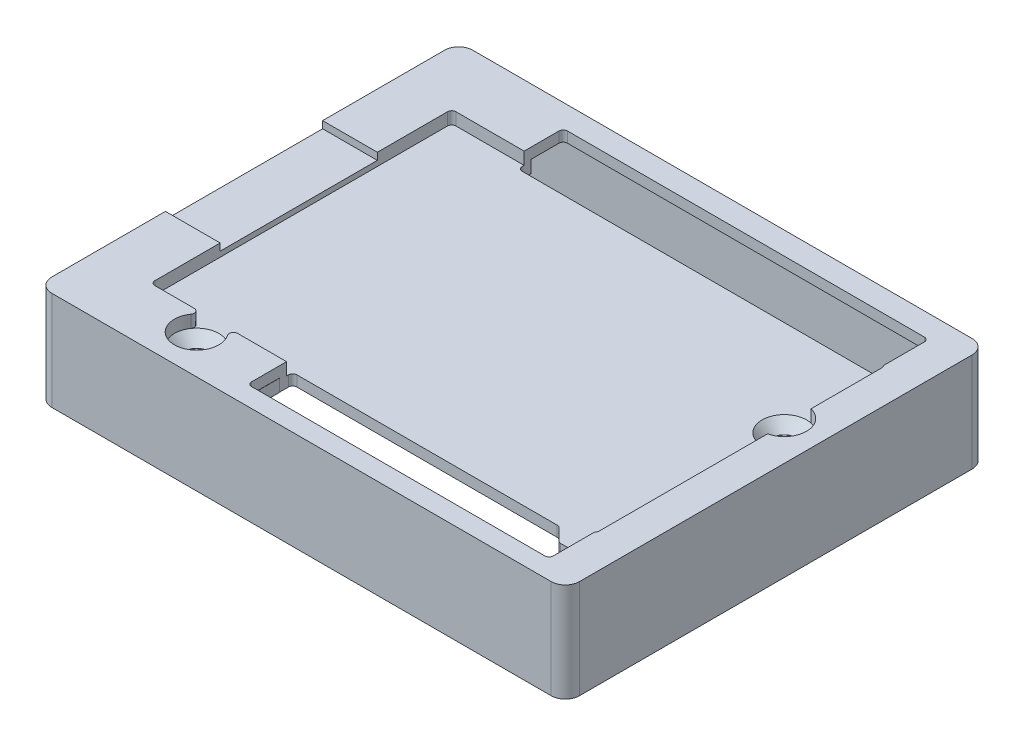
from build123d import *

# Parameters (mm, degrees)
WALLS_START                                    = 1.5
SKETCH2_W                                      = 74.7
SKETCH2_H                                      = 59.6
SKETCH2_W_2                                    = 70.7
SKETCH2_H_2                                    = 55.6
WALLS_DEPTH                                    = 12.5
BOSS_EXTRUDE2_START                            = -3
SKETCH3_W                                      = 59.6
SKETCH3_H                                      = 1.5
BOSS_EXTRUDE2_DEPTH                            = 74.7
SKETCH4_W                                      = 20.4
SKETCH4_H                                      = 16.1
CUT_EXTRUDE1_DEPTH                             = 12
SKETCH5_W                                      = 18.25
SKETCH5_H                                      = 13
CUT_EXTRUDE2_DEPTH                             = 12.1
SKETCH6_W                                      = 51.73
SKETCH6_H                                      = 6.4
SKETCH6_W_2                                    = 42.7
CUT_EXTRUDE3_DEPTH                             = 93.414555131
BOSS_EXTRUDE5_START                            = 2
BOSS_EXTRUDE5_DEPTH                            = 3.25
CUT_EXTRUDE6_DEPTH                             = 1.75
SKETCH16_W                                     = 12.95
SKETCH16_H                                     = 22.25
CUT_EXTRUDE7_DEPTH                             = 1
HOLE_PADDING_DEPTH                             = 1.5
ROOF_FILL_IN_DEPTH                             = 1.75
FILLET2_R                                      = 2
CUT_EXTRUDE9_START                             = 2
SKETCH18_W                                     = 20.4
SKETCH18_H                                     = 16.1
SKETCH18_W_2                                   = 18.25
SKETCH18_H_2                                   = 13
CUT_EXTRUDE9_DEPTH                             = 1
ROOF_FILL_IN_2_REACH                           = 94.199
CSK_FOR_M3_FLAT_HEAD_MACHINE_SCREW8_AT_2_COUNT = 2
CSK_FOR_M3_FLAT_HEAD_MACHINE_SCREW8_AT_2_PITCH = 60.711119245
HOLE_CLEARANCE_REACH                           = 94.166
SKETCH46_R                                     = 3.15
FILLET3_R                                      = 0.6


with BuildPart() as part:
    # Sketch2 → walls (new body)
    with BuildSketch(Plane(origin=(0, 0, 0), x_dir=(1, 0, 0), z_dir=(0, 1, 0)).offset(WALLS_START)):
        with Locations((34.35, 26.8)):
            Rectangle(SKETCH2_W, SKETCH2_H)
        with Locations((34.35, 26.8)):
            Rectangle(SKETCH2_W_2, SKETCH2_H_2, mode=Mode.SUBTRACT)
    extrude(amount=WALLS_DEPTH)

    # Sketch3 → Boss-Extrude2 (add)
    with BuildSketch(Plane(origin=(0, 0, 0), x_dir=(0, 0, -1), z_dir=(1, 0, 0)).offset(BOSS_EXTRUDE2_START)):
        with Locations((26.8, 14.75)):
            Rectangle(SKETCH3_W, SKETCH3_H)
    extrude(amount=BOSS_EXTRUDE2_DEPTH)

    # Sketch4 → Cut-Extrude1 (cut)
    with BuildSketch(Plane(origin=(0, 1.5, 0), x_dir=(1, 0, 0), z_dir=(0, 1, 0))):
        with Locations((1.4, 39.05)):
            Rectangle(SKETCH4_W, SKETCH4_H)
    extrude(amount=CUT_EXTRUDE1_DEPTH, mode=Mode.SUBTRACT)

    # Sketch5 → Cut-Extrude2 (cut)
    with BuildSketch(Plane(origin=(0, 1.5, 0), x_dir=(1, 0, 0), z_dir=(0, 1, 0))):
        with Locations((3.725, 8.75)):
            Rectangle(SKETCH5_W, SKETCH5_H)
    extrude(amount=CUT_EXTRUDE2_DEPTH, mode=Mode.SUBTRACT)

    # Sketch6 → Cut-Extrude3 (cut, through all)
    with BuildSketch(Plane(origin=(0, 1.5, 0), x_dir=(1, 0, 0), z_dir=(0, 1, 0))):
        with Locations((40.865, 50.2)):
            Rectangle(SKETCH6_W, SKETCH6_H)
        with Locations((45.35, 2.9)):
            Rectangle(SKETCH6_W_2, SKETCH6_H)
    extrude(amount=CUT_EXTRUDE3_DEPTH, mode=Mode.SUBTRACT)

    # Sketch13 → Boss-Extrude5 (add)
    with BuildSketch(Plane(origin=(0, 10.25, 0), x_dir=(1, 0, 0), z_dir=(0, 1, 0)).offset(BOSS_EXTRUDE5_START)):
        Polygon((3.75, 4.235), (24, 4.235), (24, 6.1), (66.7, 6.1), (66.7, 4.235), (67.9, 4.235), (67.9, 48.865), (66.73, 48.865), (66.73, 47), (15, 47), (15, 48.865), (3.75, 48.865), align=None)
    extrude(amount=BOSS_EXTRUDE5_DEPTH)

    # Sketch15 → Cut-Extrude6 (cut)
    with BuildSketch(Plane(origin=(0, 15.5, 0), x_dir=(1, 0, 0), z_dir=(0, 1, 0))):
        Polygon((4.75, 5.235), (24, 5.235), (24, 6.1), (66.9, 6.1), (66.9, 47), (15, 47), (15, 47.865), (4.75, 47.865), align=None)
    extrude(amount=-CUT_EXTRUDE6_DEPTH, mode=Mode.SUBTRACT)

    # Sketch16 → Cut-Extrude7 (cut)
    with BuildSketch(Plane(origin=(0, 15.5, 0), x_dir=(1, 0, 0), z_dir=(0, 1, 0))):
        with Locations((3.475, 26.21)):
            Rectangle(SKETCH16_W, SKETCH16_H)
    extrude(amount=-CUT_EXTRUDE7_DEPTH, mode=Mode.SUBTRACT)

    # Sketch45 → Hole padding (add)
    with BuildSketch(Plane(origin=(0, 13.75, 0), x_dir=(1, 0, 0), z_dir=(0, 1, 0))):
        Polygon((63.7, 4.1), (66.7, 4.1), (66.7, 6.1), (61.7, 6.1), align=None)
    extrude(amount=-HOLE_PADDING_DEPTH)

    # Sketch43 → Roof fill-in (add)
    with BuildSketch(Plane.XZ.offset(-14)):
        Polygon((67.9, -48.865), (67.9, -4.235), (66.7, -4.235), (66.7, -4.1), (67.9, -4.1), (69.7, -4.1), (69.7, -48.865), align=None)
    extrude(amount=ROOF_FILL_IN_DEPTH)

    # Fillet2
    fillet2_edges = [part.edges().sort_by_distance(p)[0] for p in [
        (71.7, 8.5, -56.6),
        (71.7, 8.5, 3),
        (-3, 8.5, 3),
        (-3, 8.5, -56.6),
    ]]
    fillet(fillet2_edges, radius=FILLET2_R)

    # Sketch18 → Cut-Extrude9 (cut)
    with BuildSketch(Plane(origin=(0, 10.25, 0), x_dir=(1, 0, 0), z_dir=(0, 1, 0)).offset(CUT_EXTRUDE9_START)):
        with Locations((1.4, 39.05)):
            Rectangle(SKETCH18_W, SKETCH18_H)
        with Locations((3.725, 8.75)):
            Rectangle(SKETCH18_W_2, SKETCH18_H_2)
    extrude(amount=CUT_EXTRUDE9_DEPTH, mode=Mode.SUBTRACT)

    # Roof fill in 2: up to this face of the body (flat: up to its plane)
    roof_fill_in_2_end = Plane(part.part.faces().sort_by_distance((38.949640059, 12.25, -26.379272671))[0])
    # Sketch47 → Roof fill in 2 (add, up to the picked face)
    with BuildSketch(Plane.XZ.offset(-14), mode=Mode.PRIVATE) as roof_fill_in_2_sk1:
        Polygon((3.778208992, -4.235), (11.846933601, -4.235), (11.846933601, -5.037467277), (12.85, -5.037467277), (12.85, -4.235), (24.028208992, -4.235), (24.028208992, 1), (3.778208992, 1), align=None)
    roof_fill_in_2_tool1 = split(extrude(roof_fill_in_2_sk1.sketch, amount=ROOF_FILL_IN_2_REACH, mode=Mode.PRIVATE), bisect_by=roof_fill_in_2_end, keep=Keep.BOTH, mode=Mode.PRIVATE)
    add(roof_fill_in_2_tool1.solids().sort_by(Axis((13.891493, 14, -1.640249), (0, -1, 0)))[0])

    # Sketch42 → CSK for M3 Flat Head Machine Screw8 (revolve, cut)
    with BuildSketch(Plane(origin=(66.2, 13.75, -33.5), x_dir=(0, 0, 1), z_dir=(1, 0, 0))):
        Polygon((0, 0), (0, 8.521463052), (1.7, 7.5), (1.7, 1.45), (3.15, 0), align=None)
    csk_for_m3_flat_head_machine_screw8 = revolve(axis=Axis((66.2, 20.1, -33.5), (0, -1, 0)), mode=Mode.SUBTRACT)

    # CSK for M3 Flat Head Machine Screw8 at 2: CSK for M3 Flat Head Machine Screw8 ×2
    with Locations(*[Vector(-0.8598095480534521, 0, 0.5106148657022418) * (i * CSK_FOR_M3_FLAT_HEAD_MACHINE_SCREW8_AT_2_PITCH) for i in range(1, CSK_FOR_M3_FLAT_HEAD_MACHINE_SCREW8_AT_2_COUNT)]):
        add(csk_for_m3_flat_head_machine_screw8, mode=Mode.SUBTRACT)

    # Sketch46 → Hole clearance (cut, up to next)
    with BuildSketch(Plane(origin=(0, 13.75, 0), x_dir=(1, 0, 0), z_dir=(0, 1, 0)), mode=Mode.PRIVATE) as hole_clearance_sk1:
        with Locations((66.2, 33.5)):
            Circle(SKETCH46_R)
    hole_clearance_tool1 = extrude(hole_clearance_sk1.sketch, amount=HOLE_CLEARANCE_REACH, mode=Mode.PRIVATE) & part.part
    # Sketch46 → Hole clearance (cut, up to next)
    with BuildSketch(Plane(origin=(0, 13.75, 0), x_dir=(1, 0, 0), z_dir=(0, 1, 0)), mode=Mode.PRIVATE) as hole_clearance_sk2:
        with Locations((14, 2.5)):
            Circle(SKETCH46_R)
    hole_clearance_tool2 = extrude(hole_clearance_sk2.sketch, amount=HOLE_CLEARANCE_REACH, mode=Mode.PRIVATE) & part.part
    add(hole_clearance_tool1.solids().sort_by_distance((66.2, 13.75, -33.5))[0], mode=Mode.SUBTRACT)
    add(hole_clearance_tool2.solids().sort_by_distance((14, 13.75, -2.5))[0], mode=Mode.SUBTRACT)

    # Fillet3
    # the kernel refuses this fillet: 0.6 mm, written as the material it adds along each edge
    with BuildSketch(Plane(origin=(69.7, 1.5, 1), x_dir=(-1, 0, 0), z_dir=(0, 1, 0)), Plane(origin=(-1, 1.5, 1), x_dir=(0, 0, -1), z_dir=(0, 1, 0))) as fillet3_piece_1:
        with BuildLine():
            CenterArc((FILLET3_R, -FILLET3_R), FILLET3_R, 90, 90)
            Line((0, -FILLET3_R), (0, 0))
            Line((0, 0), (FILLET3_R, 0))
        make_face()
    extrude(amount=14)
    with BuildSketch(Plane(origin=(-1, 1.5, -54.6), x_dir=(0, 0, 1), z_dir=(0, 1, 0)), Plane(origin=(69.7, 1.5, -54.6), x_dir=(-1, 0, 0), z_dir=(0, 1, 0))) as fillet3_piece_2:
        with BuildLine():
            CenterArc((FILLET3_R, FILLET3_R), FILLET3_R, 180, 90)
            Line((0, FILLET3_R), (0, 0))
            Line((0, 0), (FILLET3_R, 0))
        make_face()
    extrude(amount=14)
    with BuildSketch(Plane(origin=(12.85, 12.25, -15.25), x_dir=(0, 0, 1), z_dir=(0, 1, 0)), Plane(origin=(11.6, 12.25, -47.1), x_dir=(0, 0, 1), z_dir=(0, 1, 0)), Plane(origin=(11.6, 12.25, -31), x_dir=(-1, 0, 0), z_dir=(0, 1, 0))) as fillet3_piece_3:
        with BuildLine():
            CenterArc((FILLET3_R, -FILLET3_R), FILLET3_R, 90, 90)
            Line((0, -FILLET3_R), (0, 0))
            Line((0, 0), (FILLET3_R, 0))
        make_face()
    extrude(amount=1)
    with BuildSketch(Plane(origin=(66.9, 15.5, -6.1), x_dir=(0, 0, -1), z_dir=(0, -1, 0))) as fillet3_piece_4:
        with BuildLine():
            CenterArc((0.447213595, -0.6), FILLET3_R, 90, 48.189685102)
            Line((0, -0.2), (0, 0))
            Line((0, 0), (0.447213595, 0))
        make_face()
    extrude(amount=2.868033989)
    with BuildSketch(Plane(origin=(66.9, 15.5, -47), x_dir=(-1, 0, 0), z_dir=(0, -1, 0))) as fillet3_piece_5:
        with BuildLine():
            CenterArc((0.6, -0.418449519), FILLET3_R, 135.779955569, 44.220044431)
            Line((0, -0.418449519), (0, 0))
            Line((0, 0), (0.17, 0))
        make_face()
    extrude(amount=2.796123798)
    with BuildSketch(Plane(origin=(4.75, 15.5, -47.865), x_dir=(0, 0, 1), z_dir=(0, -1, 0)), Plane(origin=(69.7, 15.5, -48.865), x_dir=(0, 0, -1), z_dir=(0, -1, 0))) as fillet3_piece_6:
        with BuildLine():
            CenterArc((FILLET3_R, -FILLET3_R), FILLET3_R, 90, 90)
            Line((0, -FILLET3_R), (0, 0))
            Line((0, 0), (FILLET3_R, 0))
        make_face()
    extrude(amount=3.25)
    with BuildSketch(Plane(origin=(4.75, 15.5, -5.235), x_dir=(0, 0, -1), z_dir=(0, -1, 0))) as fillet3_piece_7_section:
        with BuildLine():
            CenterArc((FILLET3_R, FILLET3_R), FILLET3_R, 180, 90)
            Line((0, FILLET3_R), (0, 0))
            Line((0, 0), (FILLET3_R, 0))
        make_face()
    fillet3_piece_7 = extrude(amount=3.25, mode=Mode.PRIVATE)
    fillet3_piece_7 = split(fillet3_piece_7, bisect_by=Plane(origin=(4.75, 13.25, -5.235), z_dir=(0, 1, 0)), keep=Keep.TOP, mode=Mode.PRIVATE)
    add(fillet3_piece_7)
    with BuildSketch(Plane(origin=(24, 12.25, -6.1), x_dir=(0, 0, 1), z_dir=(0, 1, 0)), Plane(origin=(66.7, 14, 0.3), x_dir=(0, 0, -1), z_dir=(0, 1, 0)), Plane(origin=(24, 14, 0.3), x_dir=(1, 0, 0), z_dir=(0, 1, 0)), Plane(origin=(15, 14, -53.4), x_dir=(0, 0, 1), z_dir=(0, 1, 0)), Plane(origin=(66.73, 12.25, -47), x_dir=(0, 0, -1), z_dir=(0, 1, 0)), Plane(origin=(66.73, 14, -53.4), x_dir=(-1, 0, 0), z_dir=(0, 1, 0)), Plane(origin=(15, 13.75, -47), x_dir=(0, 0, -1), z_dir=(0, -1, 0))) as fillet3_piece_8:
        with BuildLine():
            CenterArc((FILLET3_R, FILLET3_R), FILLET3_R, 180, 90)
            Line((0, FILLET3_R), (0, 0))
            Line((0, 0), (FILLET3_R, 0))
        make_face()
    extrude(amount=1.5)
    with BuildSketch(Plane(origin=(11.846933601, 13.25, -4.235), x_dir=(-1, 0, 0), z_dir=(0, -1, 0)), Plane(origin=(12.85, 13.25, -5.037467277), x_dir=(-1, 0, 0), z_dir=(0, -1, 0))) as fillet3_piece_9:
        with BuildLine():
            CenterArc((FILLET3_R, FILLET3_R), FILLET3_R, 180, 90)
            Line((0, FILLET3_R), (0, 0))
            Line((0, 0), (FILLET3_R, 0))
        make_face()
    extrude(amount=1)
    with BuildSketch(Plane(origin=(61.7, 13.75, -6.1), x_dir=(-1, 0, 0), z_dir=(0, -1, 0))) as fillet3_piece_10:
        with BuildLine():
            CenterArc((FILLET3_R * 0.414213562373, -FILLET3_R), FILLET3_R, 90, 45)
            Line((-FILLET3_R * 0.292893218813, -FILLET3_R * 0.292893218813), (0, 0))
            Line((0, 0), (FILLET3_R * 0.414213562373, 0))
        make_face()
    extrude(amount=1.5)
    with BuildSketch(Plane(origin=(3.778208992, 15.5, 1), x_dir=(-1, 0, 0), z_dir=(0, -1, 0)), Plane(origin=(69.7, 15.5, -4.1), x_dir=(0, 0, 1), z_dir=(0, -1, 0))) as fillet3_piece_11:
        with BuildLine():
            CenterArc((FILLET3_R, FILLET3_R), FILLET3_R, 180, 90)
            Line((0, FILLET3_R), (0, 0))
            Line((0, 0), (FILLET3_R, 0))
        make_face()
    extrude(amount=3.25)
    # the kernel refuses this fillet: 0.6 mm, written as the material it takes off along each edge
    with BuildSketch(Plane(origin=(15.562777975, 19.300306112, -5.235), x_dir=(0.7370421688498962, 0, 0.6758467587678743), z_dir=(0, -1, 0))) as fillet3_2_piece_1:
        with BuildLine():
            CenterArc((1.525902399, -0.585144526), FILLET3_R, 102.776309415, 124.703750134)
            Line((1.120394344, -1.027369827), (0, 0))
            ThreePointArc((0, 0), (0.696607617, -0.077991239), (1.393215234, 0))
        make_face()
    extrude(amount=5.550306112, mode=Mode.SUBTRACT)
    with BuildSketch(Plane(origin=(12.437222025, 19.300306112, -5.235), x_dir=(-1, 0, 0), z_dir=(0, -1, 0))) as fillet3_2_piece_2:
        with BuildLine():
            CenterArc((1.520122445, -0.6), FILLET3_R, 90, 124.703750134)
            ThreePointArc((1.026858378, -0.9416), (0.566139315, -0.413317168), (0, 0))
            Line((0, 0), (1.520122445, 0))
        make_face()
    extrude(amount=5.550306112, mode=Mode.SUBTRACT)
    with BuildSketch(Plane(origin=(63.7, 14.371320344, -4.1), x_dir=(-0.7071067811865439, 0, -0.7071067811865511), z_dir=(0, -1, 0))) as fillet3_2_piece_3:
        with BuildLine():
            CenterArc((FILLET3_R * 0.414213562373, FILLET3_R), FILLET3_R, 225, 45)
            Line((-FILLET3_R * 0.292893218813, FILLET3_R * 0.292893218813), (0, 0))
            Line((0, 0), (FILLET3_R * 0.414213562373, 0))
        make_face()
    extrude(amount=2.742640687, mode=Mode.SUBTRACT)


solid = part.part
